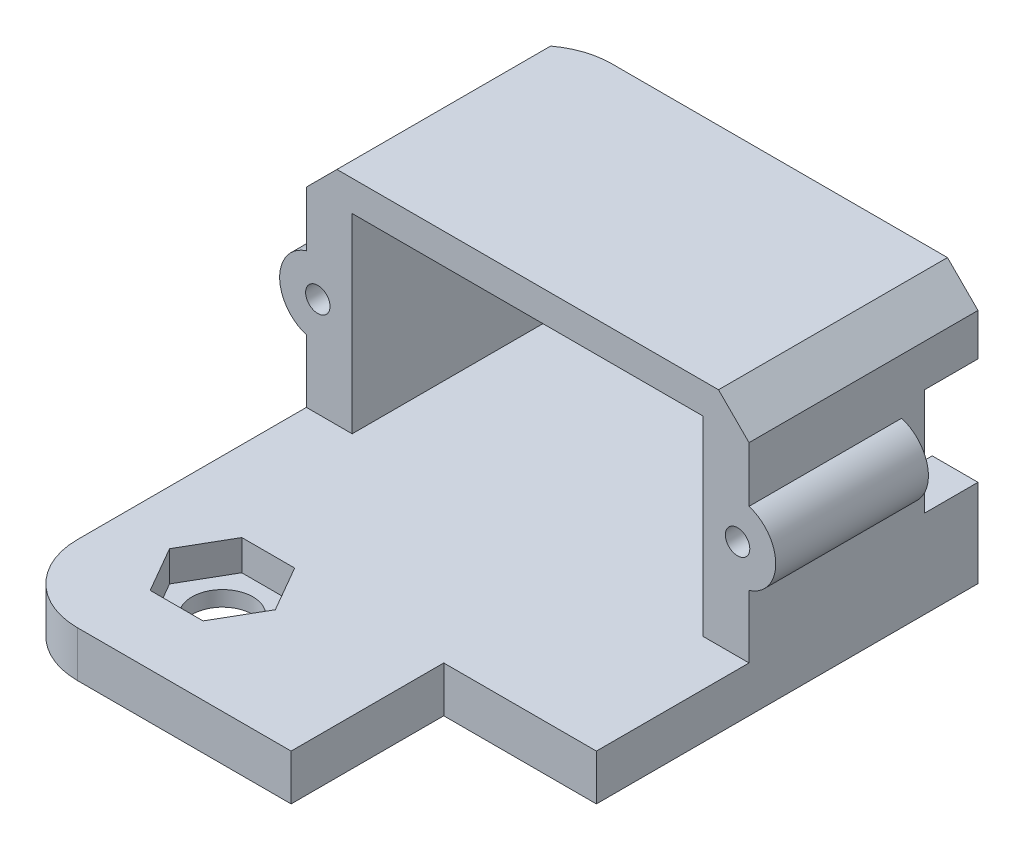
from build123d import *

# Parameters (mm, degrees)
SKETCH1_W                           = 23
SKETCH1_H                           = 15
BOSS_EXTRUDE1_DEPTH                 = 3
BOSS_EXTRUDE2_DEPTH                 = 12.5
BOSS_EXTRUDE2_DEPTH_BACK            = 3
SKETCH2_W                           = 3
SKETCH2_H                           = 15
BOSS_EXTRUDE3_DEPTH                 = 10
TAP_START                           = -2.5
TAP_DRILL_FOR_M2X0_4_TAP1_OUTLINE_R = 0.8
TAP_DRILL_FOR_M2X0_4_TAP1_DEPTH     = 10
SKETCH6_W                           = 29
SKETCH6_H                           = 20
BOSS_EXTRUDE4_DEPTH                 = 3
SKETCH7_W                           = 10
SKETCH7_H                           = 10
CUT_EXTRUDE1_DEPTH                  = 35.301056835
CUT_EXTRUDE2_DEPTH                  = 2
F_4_0_4_DIAMETER_HOLE1_D            = 4
F_4_0_4_DIAMETER_HOLE1_DEPTH        = 10
F_4_0_4_DIAMETER_HOLE1_TIP          = 1.201721238
SKETCH12_W                          = 29
SKETCH12_H                          = 15
BOSS_EXTRUDE5_DEPTH                 = 2
SKETCH13_W                          = 3
SKETCH13_H                          = 7
CUT_EXTRUDE4_DEPTH                  = 3.5
CHAMFER1_SIZE                       = 2
FILLET1_R                           = 5


# Read off the part's stored shape, not the designer's step: Tap Drill for M2x0.4 Tap1
with BuildPart() as part:
    # Sketch1 → Boss-Extrude1 (new body)
    with BuildSketch(Plane(origin=(0, 0, 0), x_dir=(1, 0, 0), z_dir=(0, 1, 0))):
        Rectangle(SKETCH1_W, SKETCH1_H)
    extrude(amount=BOSS_EXTRUDE1_DEPTH)

    # Sketch2 → Boss-Extrude2 (add, two sides: drawn at the far end of the back side and taken through both)
    with BuildSketch(Plane(origin=(0, 3, 0), x_dir=(1, 0, 0), z_dir=(0, 1, 0)).offset(-BOSS_EXTRUDE2_DEPTH_BACK)):
        with Locations((13, 0)):
            Rectangle(SKETCH2_W, SKETCH2_H)
        with Locations((-13, 0)):
            Rectangle(SKETCH2_W, SKETCH2_H)
    extrude(amount=BOSS_EXTRUDE2_DEPTH + BOSS_EXTRUDE2_DEPTH_BACK)

    # Sketch3 → Boss-Extrude3 (add)
    with BuildSketch(Plane.XY.offset(7.5)):
        with BuildLine():
            ThreePointArc((16.25, 9.5), (15.765564437, 10.979019946), (14.5, 11.884848004))
            Line((14.5, 11.884848004), (14.5, 7.115151996))
            ThreePointArc((14.5, 7.115151996), (15.765564437, 8.020980054), (16.25, 9.5))
        make_face()
        with BuildLine():
            Line((-14.5, 7.115151996), (-14.5, 11.884848004))
            ThreePointArc((-14.5, 11.884848004), (-16.25, 9.5), (-14.5, 7.115151996))
        make_face()
    extrude(amount=-BOSS_EXTRUDE3_DEPTH)

    # Tap Drill for M2x0.4 Tap1 outline → Tap Drill for M2x0.4 Tap1 (cut)
    with BuildSketch(Plane.XY.offset(TAP_START)):
        with Locations((-13.75, 9.5)):
            Circle(TAP_DRILL_FOR_M2X0_4_TAP1_OUTLINE_R)
    extrude(amount=TAP_DRILL_FOR_M2X0_4_TAP1_DEPTH, mode=Mode.SUBTRACT)

    # Tap Drill for M2x0.4 Tap1 2 outline → Tap Drill for M2x0.4 Tap1 2 (revolve, cut)
    with BuildSketch(Plane(origin=(13.75, 9.5, 0), x_dir=(1, 0, 0), z_dir=(0, -1, 0))):
        Polygon((0, 7.5), (0, -2.980688495), (0.800001695, -2.499998981), (0.8, 7.5), align=None)
    revolve(axis=Axis((13.75, 9.5, 0), (0, 0, 1)), mode=Mode.SUBTRACT)

    # Sketch6 → Boss-Extrude4 (add)
    with BuildSketch(Plane.XZ):
        with Locations((0, 17.5)):
            Rectangle(SKETCH6_W, SKETCH6_H)
    extrude(amount=-BOSS_EXTRUDE4_DEPTH)

    # Sketch7 → Cut-Extrude1 (cut, through all)
    with BuildSketch(Plane(origin=(0, 3, 0), x_dir=(1, 0, 0), z_dir=(0, 1, 0))):
        with Locations((9.5, -22.5)):
            Rectangle(SKETCH7_W, SKETCH7_H)
    extrude(amount=-CUT_EXTRUDE1_DEPTH, mode=Mode.SUBTRACT)

    # Sketch8 → Cut-Extrude2 (cut)
    with BuildSketch(Plane.XZ.offset(-3)):
        Polygon((-5.767949192, 17), (-4.035898385, 20), (-5.767949192, 23), (-9.232050808, 23), (-10.964101615, 20), (-9.232050808, 17), align=None)
    extrude(amount=CUT_EXTRUDE2_DEPTH, mode=Mode.SUBTRACT)

    # Ø4.0 (4) Diameter Hole1
    with Locations(Plane(origin=(0, 0, 0), x_dir=(-1, 0, 0), z_dir=(0, -1, 0))):
        with Locations((7.5, -20)):
            Hole(F_4_0_4_DIAMETER_HOLE1_D / 2, depth=F_4_0_4_DIAMETER_HOLE1_DEPTH)
            with Locations((0, 0, -(F_4_0_4_DIAMETER_HOLE1_DEPTH + F_4_0_4_DIAMETER_HOLE1_TIP / 2))):  # 118° drill point
                Cone(0, F_4_0_4_DIAMETER_HOLE1_D / 2, F_4_0_4_DIAMETER_HOLE1_TIP, mode=Mode.SUBTRACT)

    # Sketch12 → Boss-Extrude5 (add)
    with BuildSketch(Plane(origin=(0, 15.5, 0), x_dir=(1, 0, 0), z_dir=(0, 1, 0))):
        Rectangle(SKETCH12_W, SKETCH12_H)
    extrude(amount=BOSS_EXTRUDE5_DEPTH)

    # Sketch13 → Cut-Extrude4 (cut)
    with BuildSketch(Plane(origin=(0, 0, -7.5), x_dir=(-1, 0, 0), z_dir=(0, 0, -1))):
        with Locations((-13, 9.25)):
            Rectangle(SKETCH13_W, SKETCH13_H)
    extrude(amount=-CUT_EXTRUDE4_DEPTH, mode=Mode.SUBTRACT)

    # Chamfer1
    chamfer1_edges = [part.edges().sort_by_distance(p)[0] for p in [
        (-14.5, 17.5, 0),
        (14.5, 17.5, 0),
    ]]
    chamfer(chamfer1_edges, length=CHAMFER1_SIZE)

    # Fillet1
    # the kernel refuses this fillet: 5 mm, written as the material it takes off along each edge
    with BuildSketch(Plane(origin=(-14.5, -12.5, 27.5), x_dir=(0, 0, -1), z_dir=(0, 1, 0))) as fillet1_piece_1:
        with BuildLine():
            CenterArc((FILLET1_R, -FILLET1_R), FILLET1_R, 90, 90)
            Line((0, -FILLET1_R), (0, 0))
            Line((0, 0), (FILLET1_R, 0))
        make_face()
    extrude(amount=28, mode=Mode.SUBTRACT)
    with BuildSketch(Plane(origin=(-14.5, 28, -7.5), x_dir=(0, 0, 1), z_dir=(0, -1, 0))) as fillet1_piece_2:
        with BuildLine():
            CenterArc((FILLET1_R, -FILLET1_R), FILLET1_R, 90, 90)
            Line((0, -FILLET1_R), (0, 0))
            Line((0, 0), (FILLET1_R, 0))
        make_face()
    extrude(amount=40.5, mode=Mode.SUBTRACT)


solid = part.part
